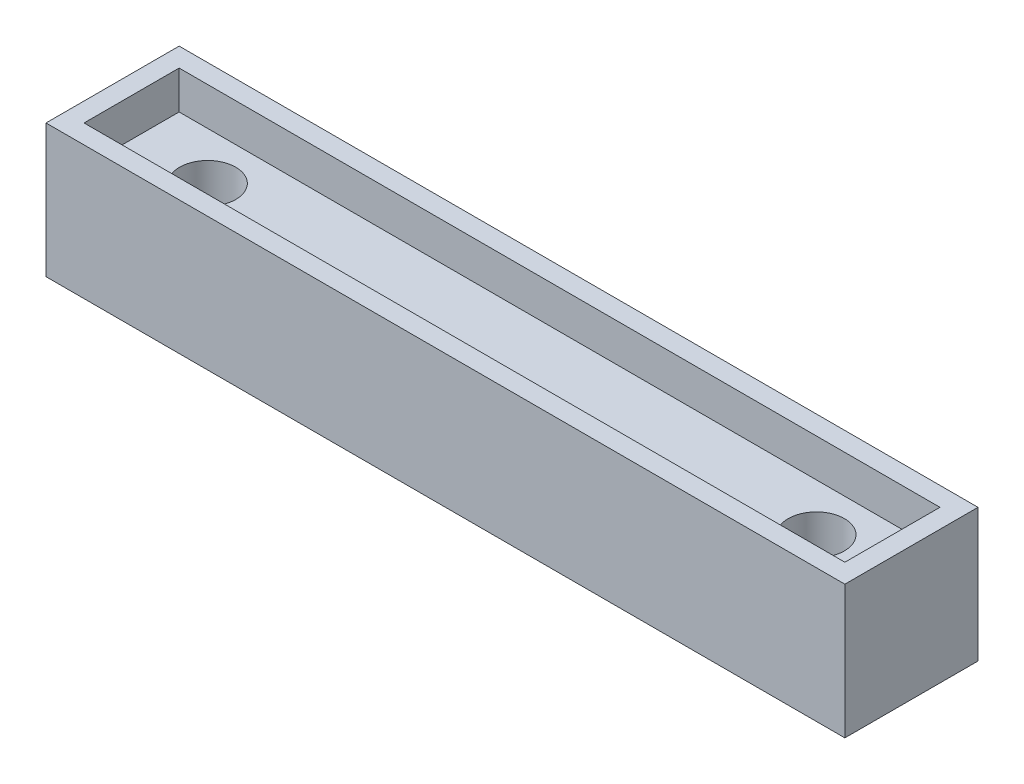
from build123d import *

# Parameters (mm, degrees)
SKETCH1_W            = 42
SKETCH1_H            = 7
RISER_DEPTH          = 7
SKETCH2_R            = 1.475
MOUNTING_HOLES_DEPTH = 44.150898021
SKETCH3_W            = 40
SKETCH3_H            = 5
RECESS_4_SIDES_DEPTH = 2


with BuildPart() as part:
    # Sketch1 → Riser (new body)
    with BuildSketch(Plane(origin=(0, 0, 0), x_dir=(1, 0, 0), z_dir=(0, 1, 0))):
        with Locations((21, 3.5)):
            Rectangle(SKETCH1_W, SKETCH1_H)
    extrude(amount=RISER_DEPTH)

    # Sketch2 → Mounting Holes (cut, through all)
    with BuildSketch(Plane.XZ):
        with Locations((5, -3.5)):
            Circle(SKETCH2_R)
        with Locations((37, -3.5)):
            Circle(SKETCH2_R)
    extrude(amount=-MOUNTING_HOLES_DEPTH, mode=Mode.SUBTRACT)

    # Sketch3 → Recess (4-Sides) (cut)
    with BuildSketch(Plane(origin=(0, 7, 0), x_dir=(1, 0, 0), z_dir=(0, 1, 0))):
        with Locations((21, 3.5)):
            Rectangle(SKETCH3_W, SKETCH3_H)
    extrude(amount=-RECESS_4_SIDES_DEPTH, mode=Mode.SUBTRACT)


solid = part.part
